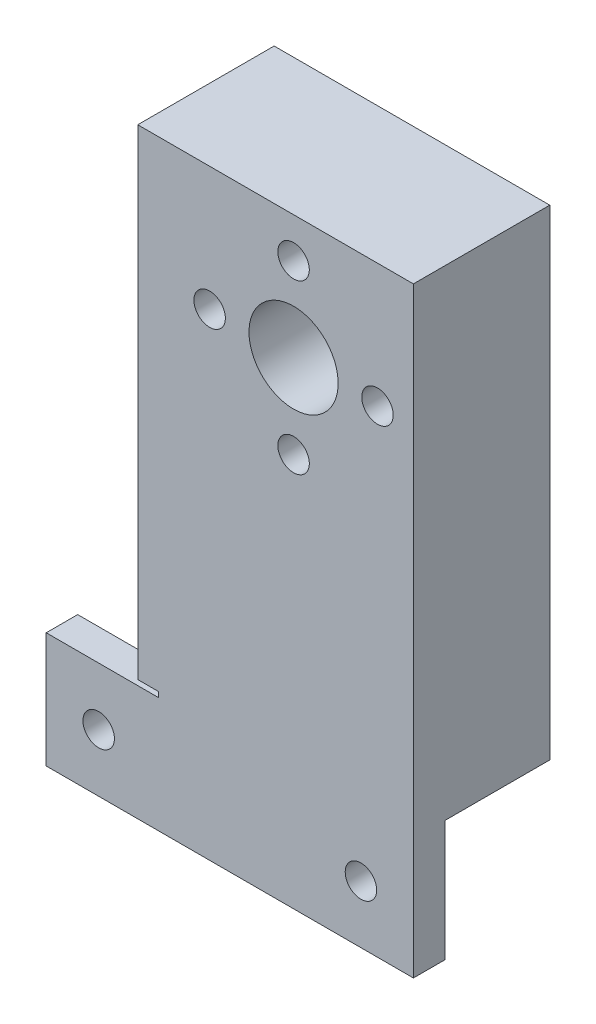
from build123d import *

# Parameters (mm, degrees)
SKETCH1_W                   = 24.274152735811775
SKETCH1_H                   = 45.79992080637105
SKETCH1_R                   = 4.250000000000006
BOSS_EXTRUDE1_DEPTH         = 2
SKETCH1_3_W                 = 24.274152735811775
SKETCH1_3_H                 = 2
SKETCH1_3_H_2               = 43.79992080637105
BOSS_EXTRUDE2_DEPTH         = 8
BOSS_EXTRUDE3_START         = -8
SKETCH1_4_W                 = 24.274152735811775
SKETCH1_4_H                 = 43.79992080637105
SKETCH1_4_H_2               = 2
SKETCH1_4_R                 = 1.500000000000004
SKETCH1_4_R_2               = 1.4999999999999971
BOSS_EXTRUDE3_DEPTH         = 3
BODY_MOVE_COPY1_START       = -81.774152736
BODY_MOVE_COPY1_OUTLINE_W   = 13.599999999999994
BODY_MOVE_COPY1_OUTLINE_H   = 22
BODY_MOVE_COPY1_DEPTH       = 24.274152736
BODY_MOVE_COPY1_2_OUTLINE_W = 13.599999999999994
BODY_MOVE_COPY1_2_OUTLINE_H = 22
BODY_MOVE_COPY1_2_DEPTH     = 8.925981831
BODY_MOVE_COPY1_START_2     = -64.996207244
BODY_MOVE_COPY1_3_OUTLINE_W = 13.599999999999994
BODY_MOVE_COPY1_3_OUTLINE_H = 22
BODY_MOVE_COPY1_3_DEPTH     = 7.496207244
BODY_MOVE_COPY1_START_3     = -92.5
BODY_MOVE_COPY1_4_OUTLINE_W = 11
BODY_MOVE_COPY1_4_OUTLINE_H = 6.000000000000002
BODY_MOVE_COPY1_4_DEPTH     = 10.725847264
BODY_MOVE_COPY1_START_4     = -11
BODY_MOVE_COPY1_5_DEPTH     = 13
BODY_MOVE_COPY1_START_5     = -22
BODY_MOVE_COPY1_6_OUTLINE_R = 1.5
BODY_MOVE_COPY1_6_DEPTH     = 11
BODY_MOVE_COPY1_START_6     = -24
BODY_MOVE_COPY1_7_OUTLINE_R = 4.25
BODY_MOVE_COPY1_7_DEPTH     = 2
SKETCH2_R                   = 2.4999999999999956
SKETCH2_R_2                 = 1.7499999999999991
BOSS_EXTRUDE4_DEPTH         = 2
SKETCH2_R_3                 = 2.499999999999995
SKETCH2_R_4                 = 1.7500000000000013
BOSS_EXTRUDE4_2_DEPTH       = 2
BOSS_EXTRUDE5_START         = 2
SKETCH2_3_R                 = 2.499999999999995
SKETCH2_3_R_2               = 2.4999999999999956
BOSS_EXTRUDE5_DEPTH         = 10
BOSS_EXTRUDE8_START         = 2
BOSS_EXTRUDE8_OUTLINE_R     = 2.5
BOSS_EXTRUDE8_OUTLINE_R_2   = 1.75
BOSS_EXTRUDE8_DEPTH         = 10
BOSS_EXTRUDE8_2_OUTLINE_R   = 2.5
BOSS_EXTRUDE8_2_OUTLINE_R_2 = 1.5
BOSS_EXTRUDE8_2_DEPTH       = 12
BOSS_EXTRUDE9_START         = -22
SKETCH1_5_R                 = 4.250000000000006
BOSS_EXTRUDE9_DEPTH         = 11
SKETCH3_R                   = 4.250000000000006
SKETCH3_R_2                 = 1.4999999999999973
SKETCH3_R_3                 = 1.4999999999999822
CUT_EXTRUDE1_DEPTH          = 3
SKETCH3_2_R                 = 1.4999999999999822
SKETCH3_2_R_2               = 1.4999999999999973
CUT_EXTRUDE2_DEPTH          = 112.56199728722034
CUT_EXTRUDE3_DEPTH          = 69.81517846049216
BOSS_EXTRUDE10_DEPTH        = 2


with BuildPart() as part:
    # Sketch1 → Boss-Extrude1 (new body)
    with BuildSketch(Plane.XY):
        with Locations((-69.63707636790589, 28.899960403185524)):
            Rectangle(SKETCH1_W, SKETCH1_H)
        with Locations((-68.92218907483289, 39.99992080637105)):
            Circle(SKETCH1_R, mode=Mode.SUBTRACT)
    extrude(amount=BOSS_EXTRUDE1_DEPTH)

    # Sketch1<3> → Boss-Extrude2 (add)
    # profile 1 of 2: a face of its own
    with BuildSketch(Plane.XY):
        with Locations((-69.63707636790589, 7)):
            Rectangle(SKETCH1_3_W, SKETCH1_3_H)
    # profile 2 of 2: a face of its own
    with BuildSketch(Plane.XY):
        with Locations((-69.63707636790589, 29.899960403185524)):
            Rectangle(SKETCH1_3_W, SKETCH1_3_H_2)
        Polygon((-61.07022541385397, 39.99992080637103), (-64.99620724434341, 33.19992080637105), (-72.84817090532232, 33.19992080637105), (-76.77415273581178, 39.999920806371065), (-72.84817090532235, 46.79992080637104), (-64.99620724434344, 46.79992080637104), align=None, mode=Mode.SUBTRACT)
    extrude(amount=-BOSS_EXTRUDE2_DEPTH)

    # Sketch1<4> → Boss-Extrude3 (add)
    # profile 1 of 7: a face of its own
    with BuildSketch(Plane.XY.offset(BOSS_EXTRUDE3_START)):
        with Locations((-69.63707636790589, 29.899960403185524)):
            Rectangle(SKETCH1_4_W, SKETCH1_4_H)
        Polygon((-61.07022541385397, 39.99992080637103), (-64.99620724434341, 33.19992080637105), (-72.84817090532232, 33.19992080637105), (-76.77415273581178, 39.999920806371065), (-72.84817090532235, 46.79992080637104), (-64.99620724434344, 46.79992080637104), align=None, mode=Mode.SUBTRACT)
    # profile 2 of 7: a face of its own
    with BuildSketch(Plane.XY.offset(BOSS_EXTRUDE3_START)):
        Polygon((-67.5, -5.500000000000001), (-67.5, 5.5), (-57.5, 5.5), (-57.49999999999999, -5.5), align=None)
        Polygon((-59.03589838486225, -2.082e-14), (-60.76794919243112, 2.999999999999975), (-64.23205080756887, 2.999999999999975), (-65.96410161513775, -2.776e-14), (-64.23205080756888, -3.0000000000000098), (-60.767949192431125, -3.0000000000000098), align=None, mode=Mode.SUBTRACT)
    # profile 3 of 7: a face of its own
    with BuildSketch(Plane.XY.offset(BOSS_EXTRUDE3_START)):
        Polygon((-67.5, 5.5), (-57.5, 5.5), (-57.5, 6), (-81.77415273581178, 6), (-81.77415273581178, 5.5), align=None)
    # profile 4 of 7: a face of its own
    with BuildSketch(Plane.XY.offset(BOSS_EXTRUDE3_START)):
        with Locations((-69.63707636790589, 7)):
            Rectangle(SKETCH1_4_W, SKETCH1_4_H_2)
    # profile 5 of 7: a face of its own
    with BuildSketch(Plane.XY.offset(BOSS_EXTRUDE3_START)):
        Polygon((-81.77415273581178, -5.500000000000003), (-67.5, -5.500000000000001), (-67.5, 5.499999999999999), (-81.77415273581178, 5.499999999999997), align=None)
    # profile 6 of 7: a face of its own
    with BuildSketch(Plane.XY.offset(BOSS_EXTRUDE3_START)):
        Polygon((-60.767949192431125, -3.0000000000000098), (-59.03589838486225, -2.082e-14), (-60.76794919243112, 2.999999999999975), (-64.23205080756887, 2.999999999999975), (-65.96410161513775, -2.776e-14), (-64.23205080756888, -3.0000000000000098), align=None)
        with Locations(Location((-62.5, 0, 0), (0, 0, 270))):
            Circle(SKETCH1_4_R, mode=Mode.SUBTRACT)
    # profile 7 of 7: a face of its own
    with BuildSketch(Plane.XY.offset(BOSS_EXTRUDE3_START)):
        Polygon((-92.5, -5.500000000000004), (-92.5, 5.499999999999996), (-81.77415273581178, 5.499999999999997), (-81.77415273581178, -5.500000000000003), align=None)
        with Locations(Location((-87.5, -2.42e-15, 0), (0, 0, 270))):
            Circle(SKETCH1_4_R_2, mode=Mode.SUBTRACT)
    extrude(amount=-BOSS_EXTRUDE3_DEPTH)

    # Body-Move/Copy1: read off the stored shape, not the designer's step
    # Body-Move/Copy1 outline → Body-Move/Copy1 (add)
    with BuildSketch(Plane.YZ.offset(BODY_MOVE_COPY1_START)):
        Polygon((6, -24), (51.799920806, -24), (51.799920806, 2), (6, 2), (6, -8), (-5.5, -8), (-5.5, -14), (6, -14), align=None)
        with Locations((39.999920806, -11)):
            Rectangle(BODY_MOVE_COPY1_OUTLINE_W, BODY_MOVE_COPY1_OUTLINE_H, mode=Mode.SUBTRACT)
    extrude(amount=BODY_MOVE_COPY1_DEPTH)

    # Body-Move_Copy1 2 outline → Body-Move_Copy1 2 (add)
    with BuildSketch(Plane.YZ.offset(BODY_MOVE_COPY1_START)):
        with Locations((39.999920806, -11)):
            Rectangle(BODY_MOVE_COPY1_2_OUTLINE_W, BODY_MOVE_COPY1_2_OUTLINE_H)
    extrude(amount=BODY_MOVE_COPY1_2_DEPTH)

    # Body-Move_Copy1 3 outline → Body-Move_Copy1 3 (add)
    with BuildSketch(Plane.YZ.offset(BODY_MOVE_COPY1_START_2)):
        with Locations((39.999920806, -11)):
            Rectangle(BODY_MOVE_COPY1_3_OUTLINE_W, BODY_MOVE_COPY1_3_OUTLINE_H)
    extrude(amount=BODY_MOVE_COPY1_3_DEPTH)

    # Body-Move_Copy1 4 outline → Body-Move_Copy1 4 (add)
    with BuildSketch(Plane.YZ.offset(BODY_MOVE_COPY1_START_3)):
        with Locations((0, -11)):
            Rectangle(BODY_MOVE_COPY1_4_OUTLINE_W, BODY_MOVE_COPY1_4_OUTLINE_H)
    extrude(amount=BODY_MOVE_COPY1_4_DEPTH)

    # Body-Move_Copy1 5 outline → Body-Move_Copy1 5 (cut)
    with BuildSketch(Plane.XY.offset(BODY_MOVE_COPY1_START_4)):
        Polygon((-81.774152736, 51.799920806), (-81.774152736, 5.5), (-92.5, 5.5), (-92.5, -5.5), (-57.5, -5.5), (-57.5, 51.799920806), align=None)
    extrude(amount=BODY_MOVE_COPY1_5_DEPTH, mode=Mode.SUBTRACT)

    # Body-Move_Copy1 6 outline → Body-Move_Copy1 6 (cut)
    with BuildSketch(Plane.XY.offset(BODY_MOVE_COPY1_START_5)):
        Polygon((-64.996207244, 33.199920806), (-61.070225414, 39.999920806), (-64.996207244, 46.799920806), align=None)
        Polygon((-72.848170905, 46.799920806), (-76.774152736, 39.999920806), (-72.848170905, 33.199920806), align=None)
        with Locations((-87.5, 0)):
            Circle(BODY_MOVE_COPY1_6_OUTLINE_R)
        with Locations((-62.5, 0)):
            Circle(BODY_MOVE_COPY1_6_OUTLINE_R)
    extrude(amount=BODY_MOVE_COPY1_6_DEPTH, mode=Mode.SUBTRACT)

    # Body-Move_Copy1 7 outline → Body-Move_Copy1 7 (cut)
    with BuildSketch(Plane.XY.offset(BODY_MOVE_COPY1_START_6)):
        with Locations((-68.922189075, 39.999920806)):
            Circle(BODY_MOVE_COPY1_7_OUTLINE_R)
    extrude(amount=BODY_MOVE_COPY1_7_DEPTH, mode=Mode.SUBTRACT)

    # Sketch2<3> → Boss-Extrude5 (add)
    with BuildSketch(Plane(origin=(-1.1724e-13, 16.499999999999897, 6.01e-15), x_dir=(1, 7.11e-15, 0), z_dir=(-7.11e-15, 1, 3.6e-16)).offset(BOSS_EXTRUDE5_START)):
        Polygon((-97.77415273581177, 38.249999999999936), (-97.77415273581177, 10.999999999999943), (-81.77415273581173, 10.999999999999943), (-81.77415273581171, 38.249999999999936), align=None)
        with Locations(Location((-95.02415273581177, 14.249999999999943, 0), (0, 0, 180))):
            Circle(SKETCH2_3_R, mode=Mode.SUBTRACT)
        with Locations(Location((-95.02415273581174, 33.249999999999936, 0), (0, 0, 180))):
            Circle(SKETCH2_3_R_2, mode=Mode.SUBTRACT)
    extrude(amount=BOSS_EXTRUDE5_DEPTH)

    # Sketch1<5> → Boss-Extrude9 (add)
    with BuildSketch(Plane.XY.offset(BOSS_EXTRUDE9_START)):
        Polygon((-76.77415273581178, 39.999920806371065), (-72.84817090532232, 33.19992080637105), (-64.99620724434341, 33.19992080637105), (-61.07022541385397, 39.99992080637103), (-64.99620724434344, 46.79992080637104), (-72.84817090532235, 46.79992080637104), align=None)
        with Locations(Location((-68.92218907483289, 39.99992080637105, 0), (0, 0, 270))):
            Circle(SKETCH1_5_R, mode=Mode.SUBTRACT)
    extrude(amount=BOSS_EXTRUDE9_DEPTH)

    # Sketch3 → Cut-Extrude1 (cut)
    # profile 1 of 5: a face of its own
    with BuildSketch(Plane(origin=(0, 0, -23.99999999999991), x_dir=(-1, 0, 0), z_dir=(0, 0, -1))):
        with Locations(Location((68.92218907483289, 39.99992080637105, 0), (0, 0, 270))):
            Circle(SKETCH3_R)
    # profile 2 of 5: a face of its own
    with BuildSketch(Plane(origin=(0, 0, -23.99999999999991), x_dir=(-1, 0, 0), z_dir=(0, 0, -1))):
        Polygon((67.190138267264, 50.999920806371065), (65.45808745969511, 47.999920806371065), (67.190138267264, 44.999920806371065), (70.65423988240175, 44.999920806371065), (72.38629068997062, 47.999920806371065), (70.65423988240177, 50.999920806371065), align=None)
        with Locations(Location((68.92218907483289, 47.99992080637105, 0), (0, 0, 90))):
            Circle(SKETCH3_R_2, mode=Mode.SUBTRACT)
    # profile 3 of 5: a face of its own
    with BuildSketch(Plane(origin=(0, 0, -23.99999999999991), x_dir=(-1, 0, 0), z_dir=(0, 0, -1))):
        Polygon((57.92218907483287, 38.26786999880217), (60.92218907483287, 36.535819191233294), (63.922189074832865, 38.267869998802176), (63.922189074832865, 41.73197161393993), (60.922189074832865, 43.464022421508815), (57.92218907483287, 41.73197161393994), align=None)
        with Locations(Location((60.922189074832886, 39.99992080637105, 0), (0, 0, 90))):
            Circle(SKETCH3_R_3, mode=Mode.SUBTRACT)
    # profile 4 of 5: a face of its own
    with BuildSketch(Plane(origin=(0, 0, -23.99999999999991), x_dir=(-1, 0, 0), z_dir=(0, 0, -1))):
        Polygon((79.92218907483291, 41.73197161393995), (76.92218907483289, 43.46402242150882), (73.92218907483291, 41.73197161393994), (73.92218907483291, 38.26786999880218), (76.92218907483291, 36.5358191912333), (79.92218907483291, 38.26786999880217), align=None)
        with Locations(Location((76.92218907483289, 39.999920806371065, 0), (0, 0, 90))):
            Circle(SKETCH3_R_3, mode=Mode.SUBTRACT)
    # profile 5 of 5: a face of its own
    with BuildSketch(Plane(origin=(0, 0, -23.99999999999991), x_dir=(-1, 0, 0), z_dir=(0, 0, -1))):
        Polygon((70.65423988240177, 28.999920806371044), (72.38629068997065, 31.999920806371048), (70.65423988240177, 34.999920806371044), (67.19013826726402, 34.999920806371044), (65.45808745969514, 31.999920806371026), (67.190138267264, 28.999920806371044), align=None)
        with Locations(Location((68.9221890748329, 31.999920806371062, 0), (0, 0, 90))):
            Circle(SKETCH3_R_3, mode=Mode.SUBTRACT)
    extrude(amount=-CUT_EXTRUDE1_DEPTH, mode=Mode.SUBTRACT)

    # Sketch3<2> → Cut-Extrude2 (cut, through all)
    with BuildSketch(Plane(origin=(0, 0, -23.99999999999991), x_dir=(-1, 0, 0), z_dir=(0, 0, -1))):
        with Locations((76.92218907483289, 39.999920806371065)):
            Circle(SKETCH3_2_R)
        with Locations((68.92218907483289, 47.99992080637105)):
            Circle(SKETCH3_2_R_2)
        with Locations((60.922189074832886, 39.99992080637105)):
            Circle(SKETCH3_2_R)
        with Locations((68.9221890748329, 31.999920806371062)):
            Circle(SKETCH3_2_R)
    extrude(amount=-CUT_EXTRUDE2_DEPTH, mode=Mode.SUBTRACT)


with BuildPart() as body_2:
    # Sketch2 → Boss-Extrude4 (new body)
    with BuildSketch(Plane(origin=(-1.1724e-13, 16.499999999999897, 6.01e-15), x_dir=(1, 7.11e-15, 0), z_dir=(-7.11e-15, 1, 3.6e-16))):
        with Locations(Location((-95.02415273581174, 33.249999999999936, 0), (0, 0, 180))):
            Circle(SKETCH2_R)
        with Locations(Location((-95.02415273581202, 33.24999999999956, 0), (0, 0, 180))):
            Circle(SKETCH2_R_2, mode=Mode.SUBTRACT)
    extrude(amount=BOSS_EXTRUDE4_DEPTH)

    # Boss-Extrude8 2 outline → Boss-Extrude8 2 (add)
    with BuildSketch(Plane(origin=(-1.1724e-13, 16.499999999999897, 6.01e-15), x_dir=(1, 7.11e-15, 0), z_dir=(-7.11e-15, 1, 3.6e-16))):
        with Locations((-95.024152736, 33.25)):
            Circle(BOSS_EXTRUDE8_2_OUTLINE_R)
        with Locations((-95.024152736, 33.25)):
            Circle(BOSS_EXTRUDE8_2_OUTLINE_R_2, mode=Mode.SUBTRACT)
    extrude(amount=BOSS_EXTRUDE8_2_DEPTH)


with BuildPart() as body_3:
    # Sketch2 → Boss-Extrude4 2 (new body)
    with BuildSketch(Plane(origin=(-1.1724e-13, 16.499999999999897, 6.01e-15), x_dir=(1, 7.11e-15, 0), z_dir=(-7.11e-15, 1, 3.6e-16))):
        with Locations(Location((-95.02415273581177, 14.249999999999943, 0), (0, 0, 180))):
            Circle(SKETCH2_R_3)
        with Locations(Location((-95.02415273581205, 14.24999999999956, 0), (0, 0, 180))):
            Circle(SKETCH2_R_4, mode=Mode.SUBTRACT)
    extrude(amount=BOSS_EXTRUDE4_2_DEPTH)

    # Boss-Extrude8: read off the stored shape, not the designer's step
    # Boss-Extrude8 outline → Boss-Extrude8 (add)
    with BuildSketch(Plane(origin=(-1.1724e-13, 16.499999999999897, 6.01e-15), x_dir=(1, 7.11e-15, 0), z_dir=(-7.11e-15, 1, 3.6e-16)).offset(BOSS_EXTRUDE8_START)):
        with Locations((-95.024152736, 14.25)):
            Circle(BOSS_EXTRUDE8_OUTLINE_R)
        with Locations((-95.024152736, 14.25)):
            Circle(BOSS_EXTRUDE8_OUTLINE_R_2, mode=Mode.SUBTRACT)
    extrude(amount=BOSS_EXTRUDE8_DEPTH)


with BuildPart() as cut_extrude3_tool:
    # Sketch4 → Cut-Extrude3 (new, through all)
    with BuildSketch(Plane.ZY.offset(81.77415273581178)):
        Polygon((-55.24015463130638, 6), (-23.99999999999991, 6), (-23.99999999999991, 18.499999999999318), (-23.99999999999991, 51.79992080637104), (-23.99999999999991, 75.17738748504144), (-55.24015463130638, 75.17738748504144), align=None)
        Polygon((-23.99999999999991, 18.499999999999318), (-23.99999999999991, 6), (-13.999999999999954, 6), (-10.999999999999954, 6), (-10.999999999999954, 18.499999999999314), align=None)
        Polygon((-23.99999999999991, 51.79992080637104), (-23.99999999999991, 18.499999999999318), (-10.999999999999954, 18.499999999999314), (-10.999999999999954, 51.79992080637105), align=None)
    extrude(amount=CUT_EXTRUDE3_DEPTH)


with BuildPart() as part_1:
    add(part.part)

    # Cut-Extrude3: cut by cut_extrude3_tool
    add(cut_extrude3_tool.part, mode=Mode.SUBTRACT)

    # Sketch4<3> → Boss-Extrude10 (add)
    with BuildSketch(Plane.ZY.offset(81.77415273581178)):
        Polygon((-23.99999999999991, 51.79992080637104), (-23.99999999999991, 18.499999999999318), (-10.999999999999954, 18.499999999999314), (-10.999999999999954, 51.79992080637105), align=None)
        Polygon((-23.99999999999991, 18.499999999999318), (-23.99999999999991, 6), (-13.999999999999954, 6), (-10.999999999999954, 6), (-10.999999999999954, 18.499999999999314), align=None)
    extrude(amount=BOSS_EXTRUDE10_DEPTH)


with BuildPart() as body_2_1:
    add(body_2.part)

    # Cut-Extrude3: cut by cut_extrude3_tool
    add(cut_extrude3_tool.part, mode=Mode.SUBTRACT)


with BuildPart() as body_3_1:
    add(body_3.part)

    # Cut-Extrude3: cut by cut_extrude3_tool
    add(cut_extrude3_tool.part, mode=Mode.SUBTRACT)


solid = part_1.part
